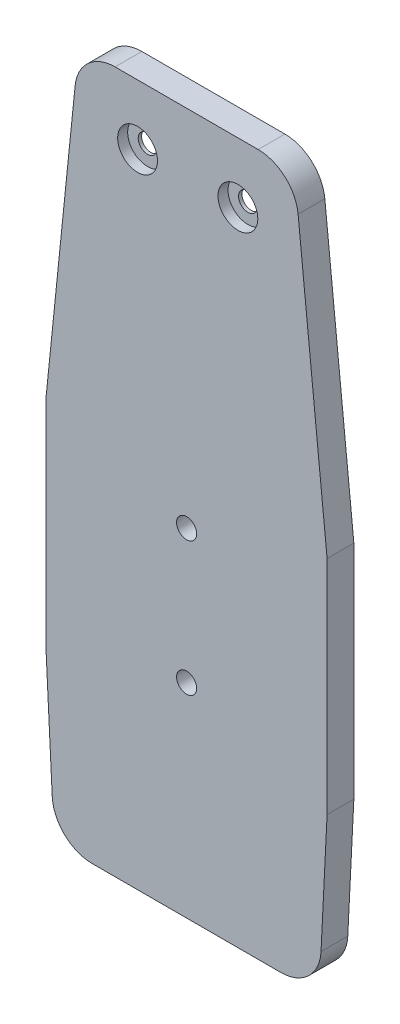
from build123d import *

# Parameters (mm, degrees)
BOSS_EXTRUDE4_DEPTH                                 = 2
BOSS_EXTRUDE5_START                                 = 2
BOSS_EXTRUDE5_DEPTH                                 = 2
BOSS_EXTRUDE6_DEPTH                                 = 2
FILLET1_R                                           = 2
CBORE_FOR_3_BINDING_HEAD_MACHINE_SCREW1_D           = 2.794
CBORE_FOR_3_BINDING_HEAD_MACHINE_SCREW1_CBORE_D     = 5.95376
CBORE_FOR_3_BINDING_HEAD_MACHINE_SCREW1_CBORE_DEPTH = 1.4986
SKETCH10_R                                          = 1.5
CUT_EXTRUDE1_DEPTH                                  = 5
SKETCH9_R                                           = 1.5
CUT_EXTRUDE2_DEPTH                                  = 5


with BuildPart() as part:
    # Sketch1 → Boss-Extrude4 (new body)
    with BuildSketch(Plane.XY):
        with BuildLine():
            Line((37.090015594, -18.299625702), (38, -0.099937578))
            Line((38, -0.099937578), (38, 33.052037892))
            Line((38, 33.052037892), (33.662977857, 75.458476622))
            ThreePointArc((33.662977857, 75.458476622), (31.715138161, 79.301265628), (27.694112953, 80.84802453))
            Line((27.694112953, 80.84802453), (6.305887047, 80.84802453))
            ThreePointArc((6.305887047, 80.84802453), (2.284861839, 79.301265628), (0.337022143, 75.458476622))
            Line((0.337022143, 75.458476622), (-4, 33.052037892))
            Line((-4, 33.052037892), (-4, -0.099937578))
            Line((-4, -0.099937578), (-3.090015594, -18.299625702))
            ThreePointArc((-3.090015594, -18.299625702), (-1.232851956, -22.347283877), (2.902498439, -24))
            Line((2.902498439, -24), (31.097501561, -24))
            ThreePointArc((31.097501561, -24), (35.232851956, -22.347283877), (37.090015594, -18.299625702))
        make_face()
    extrude(amount=BOSS_EXTRUDE4_DEPTH)

    # Sketch5 → Boss-Extrude5 (add)
    with BuildSketch(Plane(origin=(0, 0, 0), x_dir=(-1, 0, 0), z_dir=(0, 0, -1)).offset(BOSS_EXTRUDE5_START)):
        with BuildLine():
            Line((-33.662977857, 75.458476622), (-38, 33.052037892))
            Line((-38, 33.052037892), (-38, -0.099937578))
            Line((-38, -0.099937578), (-37.090015594, -18.299625702))
            ThreePointArc((-37.090015594, -18.299625702), (-35.232851956, -22.347283877), (-31.097501561, -24))
            Line((-31.097501561, -24), (-2.902498439, -24))
            ThreePointArc((-2.902498439, -24), (1.232851956, -22.347283877), (3.090015594, -18.299625702))
            Line((3.090015594, -18.299625702), (4, -0.099937578))
            Line((4, -0.099937578), (4, 33.052037892))
            Line((4, 33.052037892), (-0.337022143, 75.458476622))
            ThreePointArc((-0.337022143, 75.458476622), (-2.284861839, 79.301265628), (-6.305887047, 80.84802453))
            Line((-6.305887047, 80.84802453), (-27.694112953, 80.84802453))
            ThreePointArc((-27.694112953, 80.84802453), (-31.715138161, 79.301265628), (-33.662977857, 75.458476622))
        make_face()
        with BuildLine():
            Line((-31.097501561, -22), (-2.902498439, -22))
            ThreePointArc((-2.902498439, -22), (-0.145598176, -20.898189251), (1.092510916, -18.199750468))
            Line((1.092510916, -18.199750468), (2, -0.049968789))
            Line((2, -0.049968789), (2, 32.950031211))
            Line((2, 32.950031211), (-2.326643778, 75.254992592))
            ThreePointArc((-2.326643778, 75.254992592), (-3.625203575, 77.816851929), (-6.305887047, 78.84802453))
            Line((-6.305887047, 78.84802453), (-27.694112953, 78.84802453))
            ThreePointArc((-27.694112953, 78.84802453), (-30.374796425, 77.816851929), (-31.673356222, 75.254992592))
            Line((-31.673356222, 75.254992592), (-36, 32.950031211))
            Line((-36, 32.950031211), (-36, -0.049968789))
            Line((-36, -0.049968789), (-35.092510916, -18.199750468))
            ThreePointArc((-35.092510916, -18.199750468), (-33.854401824, -20.898189251), (-31.097501561, -22))
        make_face(mode=Mode.SUBTRACT)
    extrude(amount=-BOSS_EXTRUDE5_DEPTH)

    # Sketch6 → Boss-Extrude6 (add)
    with BuildSketch(Plane(origin=(0, 0, 0), x_dir=(-1, 0, 0), z_dir=(0, 0, -1))):
        with BuildLine():
            Line((-30.625, 65.84802453), (-3.375, 65.84802453))
            Line((-3.375, 65.84802453), (0, 32.84802453))
            Line((0, 32.84802453), (0, 0))
            Line((0, 0), (-0.904993762, -18.099875234))
            ThreePointArc((-0.904993762, -18.099875234), (-1.524048308, -19.449094626), (-2.902498439, -20))
            Line((-2.902498439, -20), (-31.097501561, -20))
            ThreePointArc((-31.097501561, -20), (-32.475951692, -19.449094626), (-33.095006238, -18.099875234))
            Line((-33.095006238, -18.099875234), (-34, 0))
            Line((-34, 0), (-34, 32.84802453))
            Line((-34, 32.84802453), (-30.625, 65.84802453))
        make_face()
    extrude(amount=BOSS_EXTRUDE6_DEPTH)

    # Fillet1
    fillet1_edges = [part.edges().sort_by_distance(p)[0] for p in [
        (3.375, 65.84802453, -1),
        (30.625, 65.84802453, -1),
    ]]
    fillet(fillet1_edges, radius=FILLET1_R)

    # CBORE for #3 Binding Head Machine Screw1 (through all)
    with Locations(Plane.XY.offset(2)):
        with Locations((24.663824929, 71.84802453), (9.664488304, 71.84802453)):
            CounterBoreHole(CBORE_FOR_3_BINDING_HEAD_MACHINE_SCREW1_D / 2, CBORE_FOR_3_BINDING_HEAD_MACHINE_SCREW1_CBORE_D / 2, CBORE_FOR_3_BINDING_HEAD_MACHINE_SCREW1_CBORE_DEPTH)

    # Sketch10 → Cut-Extrude1 (cut)
    with BuildSketch(Plane.XY.offset(2)):
        with Locations((17, 6.476050157)):
            Circle(SKETCH10_R)
    extrude(amount=-CUT_EXTRUDE1_DEPTH, mode=Mode.SUBTRACT)

    # Sketch9 → Cut-Extrude2 (cut)
    with BuildSketch(Plane.XY.offset(2)):
        with Locations((17, 6.476050157)):
            Circle(SKETCH9_R)
        with Locations((17, 26.476050157)):
            Circle(SKETCH9_R)
    extrude(amount=-CUT_EXTRUDE2_DEPTH, mode=Mode.SUBTRACT)


solid = part.part
